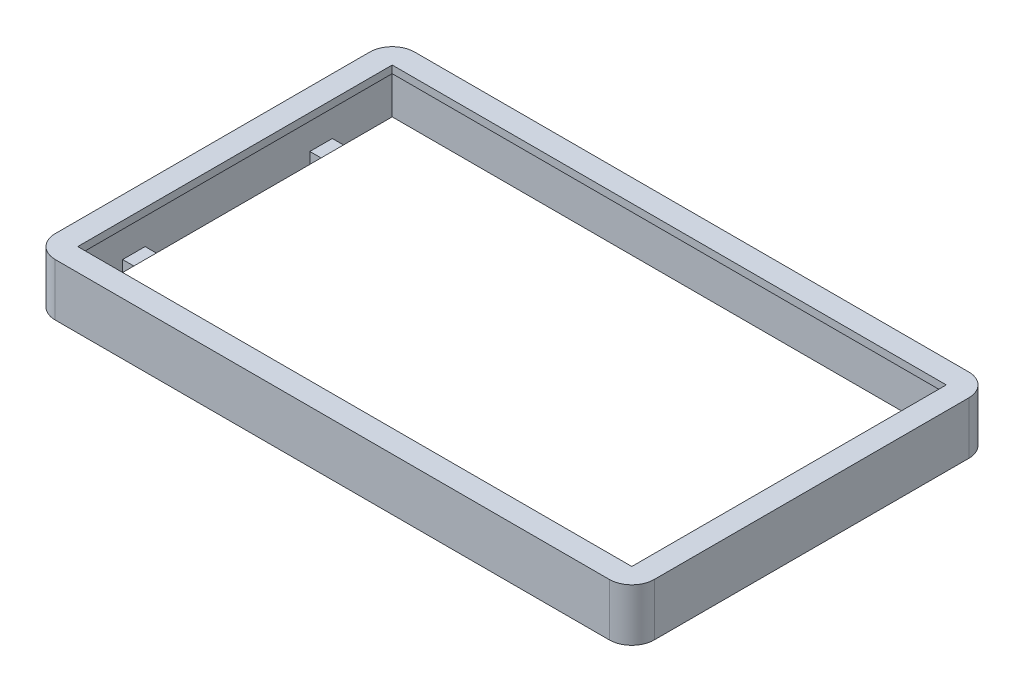
from build123d import *

# Parameters (mm, degrees)
SKETCH1_W           = 80
SKETCH1_H           = 48
SKETCH1_W_2         = 76
SKETCH1_H_2         = 44
BOSS_EXTRUDE1_DEPTH = 6
SKETCH2_W           = 80
SKETCH2_H           = 48
SKETCH2_W_2         = 74
SKETCH2_H_2         = 42
BOSS_EXTRUDE2_DEPTH = 1
FILLET1_R           = 3
SKETCH3_W           = 5
SKETCH3_H           = 1.5
SKETCH3_W_2         = 1.5
SKETCH3_H_2         = 3
BOSS_EXTRUDE3_DEPTH = 1.5
CHAMFER2_SIZE       = 1.5


with BuildPart() as part:
    # Sketch1 → Boss-Extrude1 (new body)
    with BuildSketch(Plane(origin=(0, 0, 0), x_dir=(1, 0, 0), z_dir=(0, 1, 0))):
        Rectangle(SKETCH1_W, SKETCH1_H)
        Rectangle(SKETCH1_W_2, SKETCH1_H_2, mode=Mode.SUBTRACT)
    extrude(amount=BOSS_EXTRUDE1_DEPTH)

    # Sketch2 → Boss-Extrude2 (add)
    with BuildSketch(Plane(origin=(0, 6, 0), x_dir=(1, 0, 0), z_dir=(0, 1, 0))):
        Rectangle(SKETCH2_W, SKETCH2_H)
        Rectangle(SKETCH2_W_2, SKETCH2_H_2, mode=Mode.SUBTRACT)
    extrude(amount=BOSS_EXTRUDE2_DEPTH)

    # Fillet1
    fillet1_edges = [part.edges().sort_by_distance(p)[0] for p in [
        (40, 3.5, -24),
        (40, 3.5, 24),
        (-40, 3.5, 24),
        (-40, 3.5, -24),
    ]]
    fillet(fillet1_edges, radius=FILLET1_R)

    # Sketch3 → Boss-Extrude3 (add)
    with BuildSketch(Plane.XZ):
        with Locations((-23.5, 21.25)):
            Rectangle(SKETCH3_W, SKETCH3_H)
        with Locations((-37.25, 12.5)):
            Rectangle(SKETCH3_W_2, SKETCH3_H_2)
        with Locations((23.5, 21.25)):
            Rectangle(SKETCH3_W, SKETCH3_H)
        with Locations((-37.25, -12.5)):
            Rectangle(SKETCH3_W_2, SKETCH3_H_2)
    extrude(amount=-BOSS_EXTRUDE3_DEPTH)

    # Chamfer2
    chamfer2_edges = [part.edges().sort_by_distance(p)[0] for p in [
        (23.5, 0, 20.5),
        (-23.5, 0, 20.5),
        (-36.5, 0, -12.5),
        (-36.5, 0, 12.5),
    ]]
    chamfer(chamfer2_edges, length=CHAMFER2_SIZE - 0.0001)  # a hair under: the kernel refuses the full size


solid = part.part
